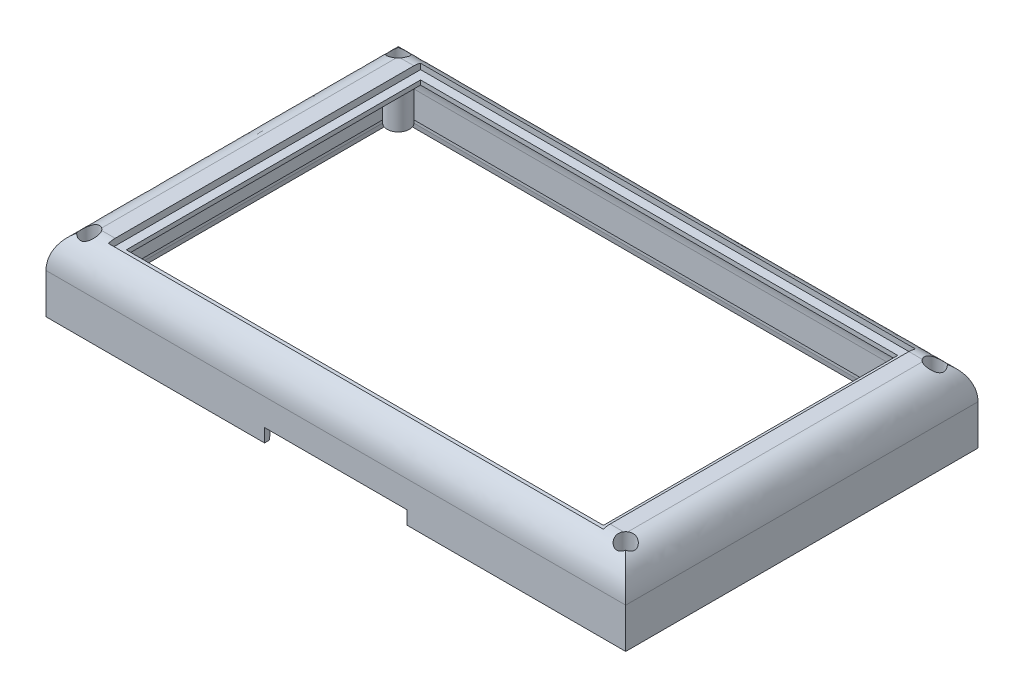
from build123d import *

# Parameters (mm, degrees)
SKETCH1_W           = 130
SKETCH1_H           = 79
BOSS_EXTRUDE1_DEPTH = 17
FILLET1_SIZE        = 8
FILLET1_SIZE_2      = 6
SHELL5_T            = -2.5
SKETCH2_W           = 111
SKETCH2_H           = 70
CUT_EXTRUDE1_DEPTH  = 1.5
SKETCH3_W           = 107
SKETCH3_H           = 66
CUT_EXTRUDE3_DEPTH  = 78.937475074
SKETCH11_W          = 127.5
SKETCH11_H          = 76.5
CUT_EXTRUDE4_DEPTH  = 3
CHAMFER1_SIZE       = 0.2
CHAMFER1_SIZE2      = 1.134256364
BOSS_EXTRUDE2_REACH = 79.339
SKETCH13_R          = 2
CUT_EXTRUDE5_DEPTH  = 10
CUT_EXTRUDE6_REACH  = 105.706
SKETCH15_W          = 31.98
SKETCH15_H          = 7.98
SKETCH14_W          = 41.4
SKETCH14_H          = 24.3
CUT_EXTRUDE7_DEPTH  = 1.25


with BuildPart() as part:
    # Sketch1 → Boss-Extrude1 (new body)
    with BuildSketch(Plane(origin=(0, 0, 0), x_dir=(1, 0, 0), z_dir=(0, 1, 0))):
        Rectangle(SKETCH1_W, SKETCH1_H)
    extrude(amount=BOSS_EXTRUDE1_DEPTH)

    # Fillet1
    # an asymmetric fillet: 8, 6 mm, written as the material it takes off along each edge
    with BuildSketch(Plane(origin=(-65, 17, 59.5), x_dir=(0, -1, 0), z_dir=(0, 0, -1)), Plane(origin=(65, 17, -59.5), x_dir=(0, -1, 0), z_dir=(0, 0, 1))) as fillet1_piece_1:
        with BuildLine():
            Bezier((FILLET1_SIZE, 0), (0, 0), (0, -FILLET1_SIZE_2), weights=[1, 0.707106781, 1])
            Line((0, -FILLET1_SIZE_2), (0, 0))
            Line((0, 0), (FILLET1_SIZE, 0))
        make_face()
    extrude(amount=119, mode=Mode.SUBTRACT)
    with BuildSketch(Plane(origin=(85, 17, 39.5), x_dir=(0, -1, 0), z_dir=(-1, 0, 0)), Plane(origin=(-85, 17, -39.5), x_dir=(0, -1, 0), z_dir=(1, 0, 0))) as fillet1_piece_2:
        with BuildLine():
            Bezier((FILLET1_SIZE, 0), (0, 0), (0, -FILLET1_SIZE_2), weights=[1, 0.707106781, 1])
            Line((0, -FILLET1_SIZE_2), (0, 0))
            Line((0, 0), (FILLET1_SIZE, 0))
        make_face()
    extrude(amount=170, mode=Mode.SUBTRACT)

    # Shell5
    shell5_openings = [part.faces().sort_by_distance(p)[0] for p in [
        (0, 0, 0),
    ]]
    offset(amount=SHELL5_T, openings=shell5_openings)

    # Sketch2 → Cut-Extrude1 (cut)
    with BuildSketch(Plane(origin=(0, 17, 0), x_dir=(1, 0, 0), z_dir=(0, 1, 0))):
        Rectangle(SKETCH2_W, SKETCH2_H)
    extrude(amount=-CUT_EXTRUDE1_DEPTH, mode=Mode.SUBTRACT)

    # Sketch3 → Cut-Extrude3 (cut, through all)
    with BuildSketch(Plane(origin=(0, 17, 0), x_dir=(1, 0, 0), z_dir=(0, 1, 0))):
        Rectangle(SKETCH3_W, SKETCH3_H)
    extrude(amount=-CUT_EXTRUDE3_DEPTH, mode=Mode.SUBTRACT)

    # Sketch11 → Cut-Extrude4 (cut)
    with BuildSketch(Plane.XZ):
        Rectangle(SKETCH11_W, SKETCH11_H)
    extrude(amount=-CUT_EXTRUDE4_DEPTH, mode=Mode.SUBTRACT)

    # Chamfer1
    chamfer1_edges = [part.edges().sort_by_distance(p)[0] for p in [
        (0, 0, -38.25),
        (63.75, 0, 0),
        (0, 0, 38.25),
        (-63.75, 0, 0),
    ]]
    chamfer1_side = [part.faces().sort_by_distance(p)[0] for p in [
        (0, 0, -39.347878338),
    ]]
    chamfer(chamfer1_edges, length=CHAMFER1_SIZE, length2=CHAMFER1_SIZE2, reference=chamfer1_side[0])

    # Sketch12 → Boss-Extrude2 (add, up to next)
    with BuildSketch(Plane.XZ.offset(-3), mode=Mode.PRIVATE) as boss_extrude2_sk1:
        with BuildLine():
            Line((-62.5, 35.502936105), (-62.5, 37))
            Line((-62.5, 37), (-61.002936105, 37))
            ThreePointArc((-61.002936105, 37), (-58.382233047, 32.882233047), (-62.5, 35.502936105))
        make_face()
    boss_extrude2_tool1 = extrude(boss_extrude2_sk1.sketch, amount=-BOSS_EXTRUDE2_REACH, mode=Mode.PRIVATE) - part.part
    # Sketch12 → Boss-Extrude2 (add, up to next)
    with BuildSketch(Plane.XZ.offset(-3), mode=Mode.PRIVATE) as boss_extrude2_sk2:
        with BuildLine():
            Line((62.5, 35.502936105), (62.5, 37))
            Line((62.5, 37), (61.002936105, 37))
            ThreePointArc((61.002936105, 37), (58.382233047, 32.882233047), (62.5, 35.502936105))
        make_face()
    boss_extrude2_tool2 = extrude(boss_extrude2_sk2.sketch, amount=-BOSS_EXTRUDE2_REACH, mode=Mode.PRIVATE) - part.part
    # Sketch12 → Boss-Extrude2 (add, up to next)
    with BuildSketch(Plane.XZ.offset(-3), mode=Mode.PRIVATE) as boss_extrude2_sk3:
        with BuildLine():
            Line((62.5, -37), (61.002936105, -37))
            ThreePointArc((61.002936105, -37), (58.382233047, -32.882233047), (62.5, -35.502936105))
            Line((62.5, -35.502936105), (62.5, -37))
        make_face()
    boss_extrude2_tool3 = extrude(boss_extrude2_sk3.sketch, amount=-BOSS_EXTRUDE2_REACH, mode=Mode.PRIVATE) - part.part
    # Sketch12 → Boss-Extrude2 (add, up to next)
    with BuildSketch(Plane.XZ.offset(-3), mode=Mode.PRIVATE) as boss_extrude2_sk4:
        with BuildLine():
            Line((-62.5, -35.502936105), (-62.5, -37))
            Line((-62.5, -37), (-61.002936105, -37))
            ThreePointArc((-61.002936105, -37), (-58.382233047, -32.882233047), (-62.5, -35.502936105))
        make_face()
    boss_extrude2_tool4 = extrude(boss_extrude2_sk4.sketch, amount=-BOSS_EXTRUDE2_REACH, mode=Mode.PRIVATE) - part.part
    add(boss_extrude2_tool1.solids().sort_by_distance((-60.224191, 3, 34.724191))[0])
    add(boss_extrude2_tool2.solids().sort_by_distance((60.224191, 3, 34.724191))[0])
    add(boss_extrude2_tool3.solids().sort_by_distance((60.224191, 3, -34.724191))[0])
    add(boss_extrude2_tool4.solids().sort_by_distance((-60.224191, 3, -34.724191))[0])

    # Sketch13 → Cut-Extrude5 (cut)
    with BuildSketch(Plane(origin=(0, 17, 0), x_dir=(1, 0, 0), z_dir=(0, 1, 0))):
        with Locations(Location((-60.15, -34.65, 0), (0, 0, 270))):
            Circle(SKETCH13_R)
        with Locations(Location((60.15, -34.65, 0), (0, 0, 314.983656829))):
            Circle(SKETCH13_R)
        with Locations(Location((60.15, 34.65, 0), (0, 0, 270))):
            Circle(SKETCH13_R)
        with Locations(Location((-60.15, 34.65, 0), (0, 0, 305.099632195))):
            Circle(SKETCH13_R)
    extrude(amount=-CUT_EXTRUDE5_DEPTH, mode=Mode.SUBTRACT)

    # Cut-Extrude6: up to this face of the body (flat: up to its plane)
    cut_extrude6_end = Plane(part.part.faces().sort_by_distance((0, 6, 37))[0])
    # Sketch15 → Cut-Extrude6 (cut, up to the picked face)
    with BuildSketch(Plane.XY.offset(39.5), mode=Mode.PRIVATE) as cut_extrude6_sk1:
        with Locations((0, -0.99)):
            Rectangle(SKETCH15_W, SKETCH15_H)
    cut_extrude6_tool1 = split(extrude(cut_extrude6_sk1.sketch, amount=-CUT_EXTRUDE6_REACH, mode=Mode.PRIVATE), bisect_by=cut_extrude6_end, keep=Keep.BOTH, mode=Mode.PRIVATE)
    add(cut_extrude6_tool1.solids().sort_by(Axis((0, -0.99, 39.5), (0, 0, -1)))[0], mode=Mode.SUBTRACT)

    # Sketch14 → Cut-Extrude7 (cut)
    with BuildSketch(Plane(origin=(0, 0, 37), x_dir=(-1, 0, 0), z_dir=(0, 0, -1))):
        with Locations((0, -4.34)):
            Rectangle(SKETCH14_W, SKETCH14_H)
    extrude(amount=-CUT_EXTRUDE7_DEPTH, mode=Mode.SUBTRACT)


solid = part.part
